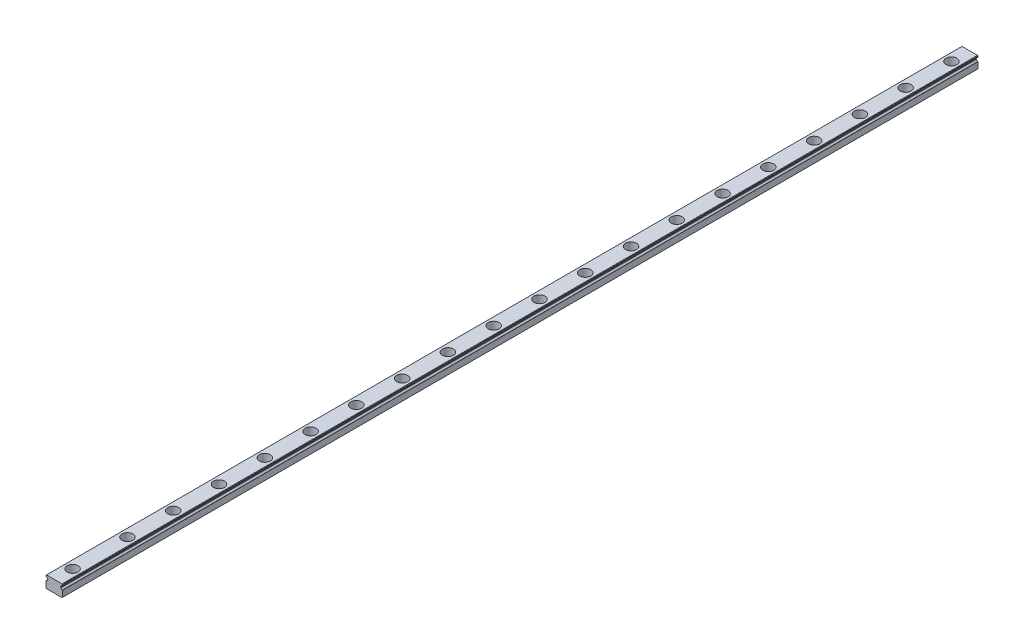
from build123d import *

# Parameters (mm, degrees)
RAIL_PROFILE_DEPTH             = 250
CBORE_FOR_M3_SHCS1_D           = 3.5
CBORE_FOR_M3_SHCS1_CBORE_D     = 6
CBORE_FOR_M3_SHCS1_CBORE_DEPTH = 4.5
FILL_START                     = -2.7
FILL_PATTERN1_OUTLINE_R        = 3
FILL_PATTERN1_DEPTH            = 4.5
FILL_START_2                   = -4.7
FILL_PATTERN1_2_OUTLINE_R      = 1.75
FILL_PATTERN1_2_DEPTH          = 2


# Read off the part's stored shape, not the designer's step: Fill Pattern1
with BuildPart() as part:
    # Sketch1 → RAIL PROFILE (new, symmetric)
    with BuildSketch(Plane.XY):
        with BuildLine():
            Line((-4.5, -1.081665383), (-4.5, -4.45))
            Line((-4.5, -4.45), (-4.25, -4.7))
            Line((-4.25, -4.7), (4.25, -4.7))
            Line((4.25, -4.7), (4.5, -4.45))
            Line((4.5, -4.45), (4.5, -1.081665383))
            ThreePointArc((4.5, -1.081665383), (4.476870611, -1.017705168), (4.418181818, -0.983332166))
            ThreePointArc((4.418181818, -0.983332166), (3.946606362, -0.757018331), (3.653800296, -0.32358325))
            ThreePointArc((3.653800296, -0.32358325), (3.620829122, -0.277205142), (3.5678959, -0.256322105))
            Line((3.5678959, -0.256322105), (3.491284426, -0.24961947))
            ThreePointArc((3.491284426, -0.24961947), (3.426272266, -0.217559021), (3.4, -0.15))
            Line((3.4, -0.15), (3.4, 0.15))
            ThreePointArc((3.4, 0.15), (3.426272266, 0.217559021), (3.491284426, 0.24961947))
            Line((3.491284426, 0.24961947), (3.5678959, 0.256322105))
            ThreePointArc((3.5678959, 0.256322105), (3.620829122, 0.277205142), (3.653800296, 0.32358325))
            ThreePointArc((3.653800296, 0.32358325), (3.946606362, 0.757018331), (4.418181818, 0.983332166))
            ThreePointArc((4.418181818, 0.983332166), (4.476870611, 1.017705168), (4.5, 1.081665383))
            Line((4.5, 1.081665383), (4.5, 1.55))
            Line((4.5, 1.55), (4.25, 1.8))
            Line((4.25, 1.8), (-4.25, 1.8))
            Line((-4.25, 1.8), (-4.5, 1.55))
            Line((-4.5, 1.55), (-4.5, 1.081665383))
            ThreePointArc((-4.5, 1.081665383), (-4.476870611, 1.017705168), (-4.418181818, 0.983332166))
            ThreePointArc((-4.418181818, 0.983332166), (-3.946606362, 0.757018331), (-3.653800296, 0.32358325))
            ThreePointArc((-3.653800296, 0.32358325), (-3.620829122, 0.277205142), (-3.5678959, 0.256322105))
            Line((-3.5678959, 0.256322105), (-3.491284426, 0.24961947))
            ThreePointArc((-3.491284426, 0.24961947), (-3.426272266, 0.217559021), (-3.4, 0.15))
            Line((-3.4, 0.15), (-3.4, -0.15))
            ThreePointArc((-3.4, -0.15), (-3.426272266, -0.217559021), (-3.491284426, -0.24961947))
            Line((-3.491284426, -0.24961947), (-3.5678959, -0.256322105))
            ThreePointArc((-3.5678959, -0.256322105), (-3.620829122, -0.277205142), (-3.653800296, -0.32358325))
            ThreePointArc((-3.653800296, -0.32358325), (-3.946606362, -0.757018331), (-4.418181818, -0.983332166))
            ThreePointArc((-4.418181818, -0.983332166), (-4.476870611, -1.017705168), (-4.5, -1.081665383))
        make_face()
    extrude(amount=RAIL_PROFILE_DEPTH, both=True)

    # CBORE for M3 SHCS1 (through all)
    with Locations(Plane(origin=(0, 1.8, 0), x_dir=(1, 0, 0), z_dir=(0, 1, 0))):
        with Locations((0, 240)):
            cbore_for_m3_shcs1 = CounterBoreHole(CBORE_FOR_M3_SHCS1_D / 2, CBORE_FOR_M3_SHCS1_CBORE_D / 2, CBORE_FOR_M3_SHCS1_CBORE_DEPTH)

    # M3 END MIRROR: CBORE for M3 SHCS1 across plane
    add(cbore_for_m3_shcs1.mirror(Plane.XY), mode=Mode.SUBTRACT)

    # Fill Pattern1 outline → Fill Pattern1 (cut)
    with BuildSketch(Plane(origin=(0, 0, 0), x_dir=(1, 0, 0), z_dir=(0, 1, 0)).offset(FILL_START)):
        with Locations((0, 215)):
            Circle(FILL_PATTERN1_OUTLINE_R)
        with Locations((0, 190)):
            Circle(FILL_PATTERN1_OUTLINE_R)
        with Locations((0, 165)):
            Circle(FILL_PATTERN1_OUTLINE_R)
        with Locations((0, 140)):
            Circle(FILL_PATTERN1_OUTLINE_R)
        with Locations((0, 115)):
            Circle(FILL_PATTERN1_OUTLINE_R)
        with Locations((0, 90)):
            Circle(FILL_PATTERN1_OUTLINE_R)
        with Locations((0, 65)):
            Circle(FILL_PATTERN1_OUTLINE_R)
        with Locations((0, 40)):
            Circle(FILL_PATTERN1_OUTLINE_R)
        with Locations((0, 15)):
            Circle(FILL_PATTERN1_OUTLINE_R)
        with Locations((0, -10)):
            Circle(FILL_PATTERN1_OUTLINE_R)
        with Locations((0, -35)):
            Circle(FILL_PATTERN1_OUTLINE_R)
        with Locations((0, -60)):
            Circle(FILL_PATTERN1_OUTLINE_R)
        with Locations((0, -85)):
            Circle(FILL_PATTERN1_OUTLINE_R)
        with Locations((0, -110)):
            Circle(FILL_PATTERN1_OUTLINE_R)
        with Locations((0, -135)):
            Circle(FILL_PATTERN1_OUTLINE_R)
        with Locations((0, -160)):
            Circle(FILL_PATTERN1_OUTLINE_R)
        with Locations((0, -185)):
            Circle(FILL_PATTERN1_OUTLINE_R)
        with Locations((0, -210)):
            Circle(FILL_PATTERN1_OUTLINE_R)
    extrude(amount=FILL_PATTERN1_DEPTH, mode=Mode.SUBTRACT)

    # Fill Pattern1 2 outline → Fill Pattern1 2 (cut)
    with BuildSketch(Plane(origin=(0, 0, 0), x_dir=(1, 0, 0), z_dir=(0, 1, 0)).offset(FILL_START_2)):
        with Locations((0, 215)):
            Circle(FILL_PATTERN1_2_OUTLINE_R)
        with Locations((0, 190)):
            Circle(FILL_PATTERN1_2_OUTLINE_R)
        with Locations((0, 165)):
            Circle(FILL_PATTERN1_2_OUTLINE_R)
        with Locations((0, 140)):
            Circle(FILL_PATTERN1_2_OUTLINE_R)
        with Locations((0, 115)):
            Circle(FILL_PATTERN1_2_OUTLINE_R)
        with Locations((0, 90)):
            Circle(FILL_PATTERN1_2_OUTLINE_R)
        with Locations((0, 65)):
            Circle(FILL_PATTERN1_2_OUTLINE_R)
        with Locations((0, 40)):
            Circle(FILL_PATTERN1_2_OUTLINE_R)
        with Locations((0, 15)):
            Circle(FILL_PATTERN1_2_OUTLINE_R)
        with Locations((0, -10)):
            Circle(FILL_PATTERN1_2_OUTLINE_R)
        with Locations((0, -35)):
            Circle(FILL_PATTERN1_2_OUTLINE_R)
        with Locations((0, -60)):
            Circle(FILL_PATTERN1_2_OUTLINE_R)
        with Locations((0, -85)):
            Circle(FILL_PATTERN1_2_OUTLINE_R)
        with Locations((0, -110)):
            Circle(FILL_PATTERN1_2_OUTLINE_R)
        with Locations((0, -135)):
            Circle(FILL_PATTERN1_2_OUTLINE_R)
        with Locations((0, -160)):
            Circle(FILL_PATTERN1_2_OUTLINE_R)
        with Locations((0, -185)):
            Circle(FILL_PATTERN1_2_OUTLINE_R)
        with Locations((0, -210)):
            Circle(FILL_PATTERN1_2_OUTLINE_R)
    extrude(amount=FILL_PATTERN1_2_DEPTH, mode=Mode.SUBTRACT)


solid = part.part
